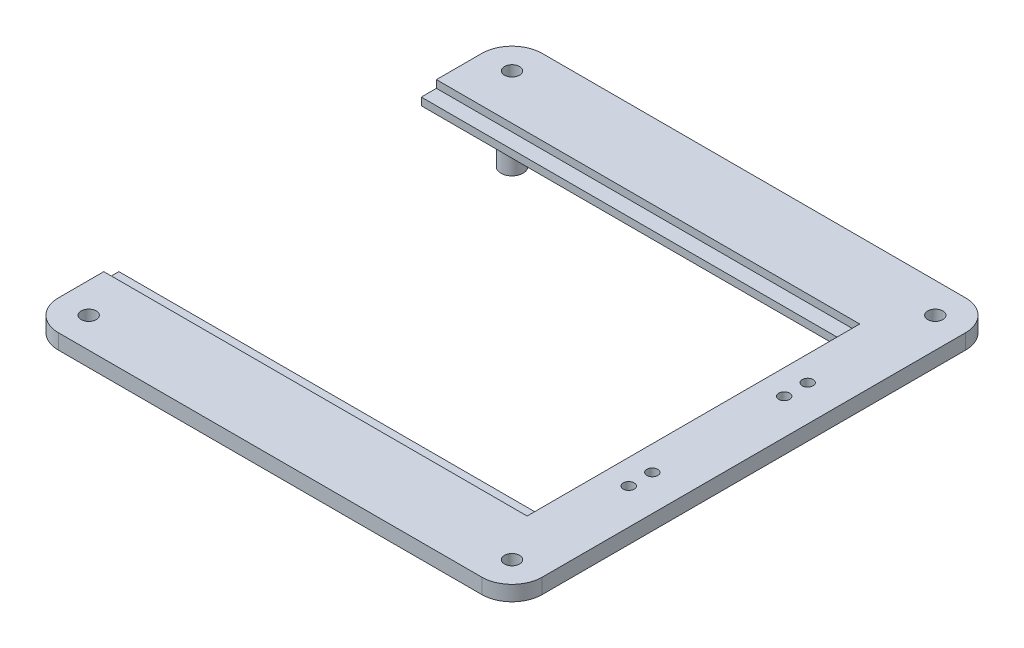
from build123d import *

# Parameters (mm, degrees)
BOSS_EXTRUDE2_DEPTH = 6.35
SKETCH2_R           = 3.175
CUT_EXTRUDE1_DEPTH  = 262.894200967
SKETCH5_R           = 4.6625
BOSS_EXTRUDE3_DEPTH = 12.7
SKETCH6_W           = 177.8
SKETCH6_H           = 6.35
CUT_EXTRUDE2_DEPTH  = 3.175
SKETCH7_R           = 2.286
CUT_EXTRUDE3_DEPTH  = 12.7


with BuildPart() as part:
    # Sketch1 → Boss-Extrude2 (new body)
    with BuildSketch(Plane(origin=(0, 0, 0), x_dir=(1, 0, 0), z_dir=(0, 1, 0))):
        with BuildLine():
            Line((0, 0), (0, 25.4))
            ThreePointArc((0, 25.4), (3.719743879, 34.380256121), (12.7, 38.1))
            Line((12.7, 38.1), (190.5, 38.1))
            ThreePointArc((190.5, 38.1), (199.480256121, 34.380256121), (203.2, 25.4))
            Line((203.2, 25.4), (203.2, -152.4))
            ThreePointArc((203.2, -152.4), (199.480256121, -161.380256121), (190.5, -165.1))
            Line((190.5, -165.1), (12.7, -165.1))
            ThreePointArc((12.7, -165.1), (3.719743879, -161.380256121), (0, -152.4))
            Line((0, -152.4), (0, -127))
            Line((0, -127), (177.8, -127))
            Line((177.8, -127), (177.8, 0))
            Line((177.8, 0), (0, 0))
        make_face()
    extrude(amount=BOSS_EXTRUDE2_DEPTH)

    # Sketch2 → Cut-Extrude1 (cut, through all)
    with BuildSketch(Plane(origin=(0, 6.35, 0), x_dir=(1, 0, 0), z_dir=(0, 1, 0))):
        with Locations((12.7, 25.4)):
            Circle(SKETCH2_R)
        with Locations((190.5, 25.4)):
            Circle(SKETCH2_R)
        with Locations((190.5, -152.4)):
            Circle(SKETCH2_R)
        with Locations((12.7, -152.4)):
            Circle(SKETCH2_R)
    extrude(amount=-CUT_EXTRUDE1_DEPTH, mode=Mode.SUBTRACT)

    # Sketch5 → Boss-Extrude3 (add)
    with BuildSketch(Plane.XZ):
        with Locations((28.575, 136.525)):
            Circle(SKETCH5_R)
        with Locations((174.625, 136.525)):
            Circle(SKETCH5_R)
        with Locations((174.625, -9.525)):
            Circle(SKETCH5_R)
        with Locations((28.575, -9.525)):
            Circle(SKETCH5_R)
    extrude(amount=BOSS_EXTRUDE3_DEPTH)

    # Sketch6 → Cut-Extrude2 (cut)
    with BuildSketch(Plane(origin=(0, 6.35, 0), x_dir=(1, 0, 0), z_dir=(0, 1, 0))):
        with Locations((88.9, -130.175)):
            Rectangle(SKETCH6_W, SKETCH6_H)
        with Locations((88.9, 3.175)):
            Rectangle(SKETCH6_W, SKETCH6_H)
    extrude(amount=-CUT_EXTRUDE2_DEPTH, mode=Mode.SUBTRACT)

    # Sketch7 → Cut-Extrude3 (cut)
    with BuildSketch(Plane(origin=(0, 6.35, 0), x_dir=(1, 0, 0), z_dir=(0, 1, 0))):
        with Locations((188.214, -101.092)):
            Circle(SKETCH7_R)
        with Locations((188.214, -91.186)):
            Circle(SKETCH7_R)
        with Locations((188.214, -35.814)):
            Circle(SKETCH7_R)
        with Locations((188.214, -25.908)):
            Circle(SKETCH7_R)
    extrude(amount=-CUT_EXTRUDE3_DEPTH, mode=Mode.SUBTRACT)


solid = part.part
